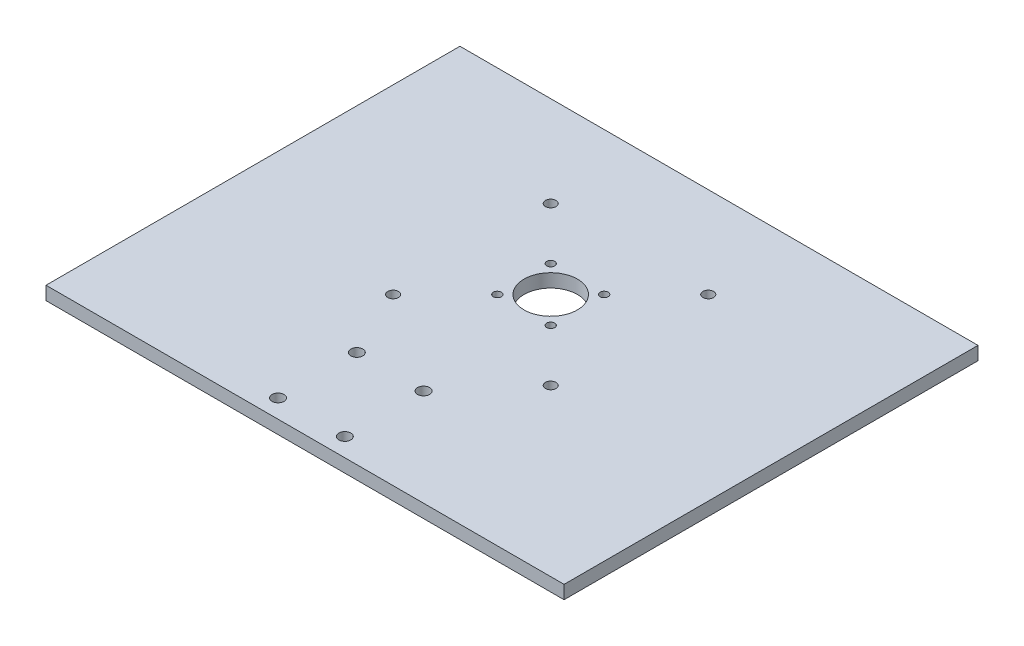
from build123d import *

# Parameters (mm, degrees)
SKETCH1_W           = 194
SKETCH1_H           = 155
BOSS_EXTRUDE1_DEPTH = 5
SKETCH2_R           = 2
CUT_EXTRUDE1_DEPTH  = 249.36666443
SKETCH3_R           = 10
SKETCH3_R_2         = 1.5
CUT_EXTRUDE2_DEPTH  = 249.36666443
SKETCH4_R           = 2.25
CUT_EXTRUDE3_DEPTH  = 249.36666443


with BuildPart() as part:
    # Sketch1 → Boss-Extrude1 (new body)
    with BuildSketch(Plane(origin=(0, 0, 0), x_dir=(1, 0, 0), z_dir=(0, 1, 0))):
        with Locations((97, 77.5)):
            Rectangle(SKETCH1_W, SKETCH1_H)
    extrude(amount=BOSS_EXTRUDE1_DEPTH)

    # Sketch2 → Cut-Extrude1 (cut, through all)
    with BuildSketch(Plane(origin=(0, 5, 0), x_dir=(1, 0, 0), z_dir=(0, 1, 0))):
        with Locations((68, 121)):
            Circle(SKETCH2_R)
        with Locations((127, 121)):
            Circle(SKETCH2_R)
        with Locations((68, 62)):
            Circle(SKETCH2_R)
        with Locations((127, 62)):
            Circle(SKETCH2_R)
    extrude(amount=-CUT_EXTRUDE1_DEPTH, mode=Mode.SUBTRACT)

    # Sketch3 → Cut-Extrude2 (cut, through all)
    with BuildSketch(Plane(origin=(0, 5, 0), x_dir=(1, 0, 0), z_dir=(0, 1, 0))):
        with Locations((97.5, 91.5)):
            Circle(SKETCH3_R)
        with Locations((107.5, 101.5)):
            Circle(SKETCH3_R_2)
        with Locations((107.5, 81.5)):
            Circle(SKETCH3_R_2)
        with Locations((87.5, 81.5)):
            Circle(SKETCH3_R_2)
        with Locations((87.5, 101.5)):
            Circle(SKETCH3_R_2)
    extrude(amount=-CUT_EXTRUDE2_DEPTH, mode=Mode.SUBTRACT)

    # Sketch4 → Cut-Extrude3 (cut, through all)
    with BuildSketch(Plane(origin=(0, 0, 0), x_dir=(-1, 0, 0), z_dir=(0, -1, 0))):
        with Locations((-80, 6.896410277)):
            Circle(SKETCH4_R)
        with Locations((-105, 6.896410277)):
            Circle(SKETCH4_R)
        with Locations((-80, 36.396410277)):
            Circle(SKETCH4_R)
        with Locations((-105, 36.396410277)):
            Circle(SKETCH4_R)
    extrude(amount=-CUT_EXTRUDE3_DEPTH, mode=Mode.SUBTRACT)


solid = part.part
